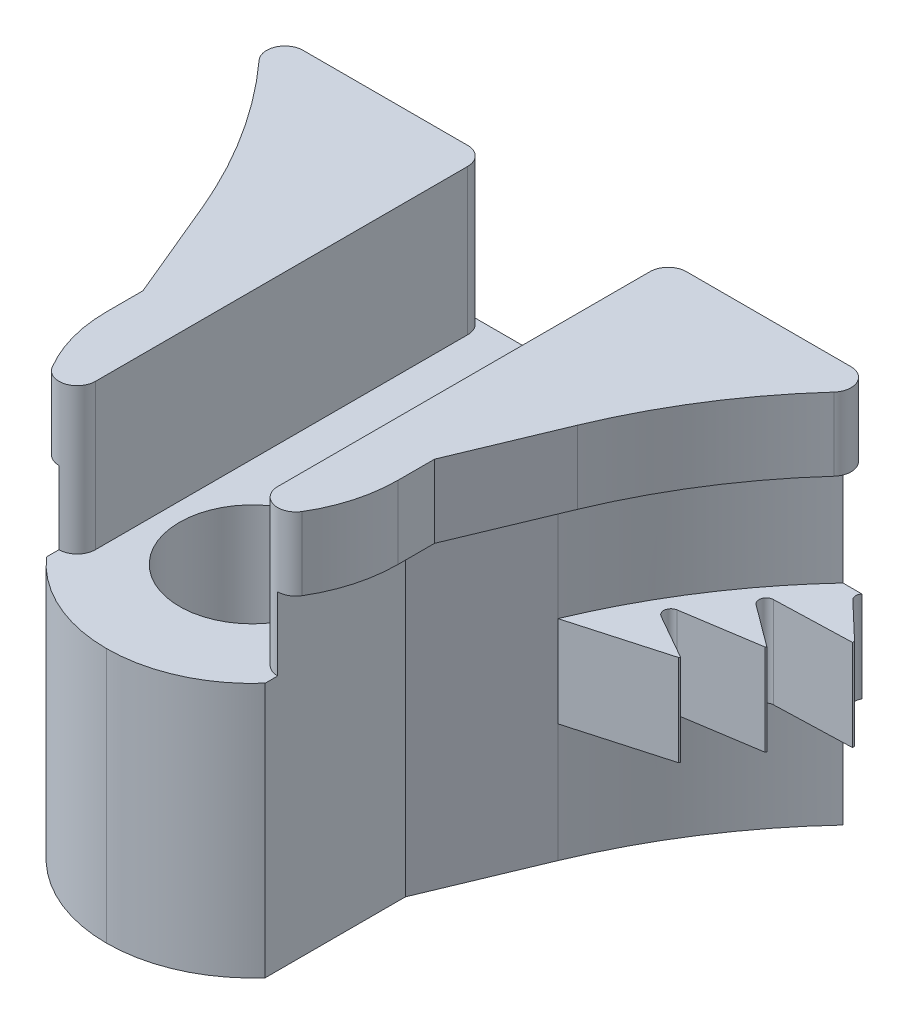
from build123d import *

# Parameters (mm, degrees)
BOSS_EXTRUDE1_DEPTH  = 2.54
BOSS_EXTRUDE2_DEPTH  = 11.43
BOSS_EXTRUDE3_DEPTH  = 1.5875
CUT_EXTRUDE1_DEPTH   = 5.08
CUT_EXTRUDE2_DEPTH   = 5.08
CIRPATTERN1_COUNT    = 10
CIRPATTERN1_ANGLE    = 63
FILLET1_R            = 0.254
MIRROR1_COPY_1_DEPTH = 5.08
MIRROR1_COPY_2_DEPTH = 5.08
MIRROR1_COPY_3_DEPTH = 5.08
MIRROR1_COPY_4_DEPTH = 5.08
MIRROR1_COPY_5_DEPTH = 5.08
MIRROR1_COPY_6_DEPTH = 5.08
MIRROR1_COPY_7_DEPTH = 5.08
MIRROR1_COPY_8_DEPTH = 5.08
MIRROR1_COPY_9_DEPTH = 5.08
FILLET1_OF_MIRROR1_R = 0.254
FILLET3_R            = 5.08
SKETCH8_R            = 2.54
CUT_EXTRUDE3_DEPTH   = 37.969969278
SKETCH9_W            = 6.35
SKETCH9_H            = 5.08
CUT_EXTRUDE4_DEPTH   = 37.086876125
FILLET5_R            = 1.27
FILLET6_R            = 0.635
SKETCH10_W           = 12.288229788
SKETCH10_H           = 22.793910423
CUT_EXTRUDE5_DEPTH   = 37.969969278
SKETCH11_W           = 22.446987528
SKETCH11_H           = 9.005342915
CUT_EXTRUDE6_DEPTH   = 32.085168686
FILLET7_R            = 0.635


# Some blends are built 0.0001 mm under size
with BuildPart() as part:
    # Sketch1 → Boss-Extrude1 (new body)
    with BuildSketch(Plane(origin=(0, 0, 0), x_dir=(1, 0, 0), z_dir=(0, 1, 0))):
        with BuildLine():
            Line((-22.86, 25.4), (22.86, 25.4))
            Line((22.86, 25.4), (22.86, 21.547619525))
            ThreePointArc((22.86, 21.547619525), (13.040193974, 18.029309291), (6.545384615, 9.866923077))
            Line((6.545384615, 9.866923077), (5.08, 6.35))
            Line((5.08, 6.35), (5.08, 0))
            Line((5.08, 0), (-5.08, 0))
            Line((-5.08, 0), (-5.08, 6.35))
            Line((-5.08, 6.35), (-6.545384615, 9.866923077))
            ThreePointArc((-6.545384615, 9.866923077), (-13.040193974, 18.029309291), (-22.86, 21.547619525))
            Line((-22.86, 21.547619525), (-22.86, 25.4))
        make_face()
    extrude(amount=BOSS_EXTRUDE1_DEPTH)

    # Sketch3 → Boss-Extrude2 (add)
    with BuildSketch(Plane.XZ):
        with BuildLine():
            Line((-3.81, 0), (0, 0))
            Line((0, 0), (0, -25.4))
            Line((0, -25.4), (-21.59, -25.4))
            Line((-21.59, -25.4), (-22.86, -25.4))
            Line((-22.86, -25.4), (-22.86, -22.70062499))
            Line((-22.86, -22.70062499), (-21.59, -22.70062499))
            ThreePointArc((-21.59, -22.70062499), (-11.821833073, -18.70822275), (-5.373076923, -10.355384615))
            Line((-5.373076923, -10.355384615), (-3.81, -6.604))
            Line((-3.81, -6.604), (-3.81, 0))
        make_face()
    boss_extrude2 = extrude(amount=BOSS_EXTRUDE2_DEPTH)

    # Sketch4 → Boss-Extrude3 (add, symmetric)
    with BuildSketch(Plane(origin=(0, -5.715, 0), x_dir=(-1, 0, 0), z_dir=(0, -1, 0))):
        with BuildLine():
            Line((22.944666667, 20.28044489), (22.944666667, 25.4))
            Line((22.944666667, 25.4), (0, 25.4))
            Line((0, 25.4), (0, 0))
            Line((0, 0), (3.81, 0))
            Line((3.81, 0), (3.81, 6.604))
            Line((3.81, 6.604), (4.966025641, 9.378461538))
            Line((4.966025641, 9.378461538), (7.717692308, 9.378461538))
            ThreePointArc((7.717692308, 9.378461538), (13.779514375, 16.996688671), (22.944666667, 20.28044489))
        make_face()
    boss_extrude3 = extrude(amount=BOSS_EXTRUDE3_DEPTH, both=True)

    # Sketch6 → Cut-Extrude1 (cut)
    with BuildSketch(Plane.XZ.offset(7.3025)):
        Polygon((-7.717692308, -9.378461538), (-5.373076923, -10.355384615), (-8.648388962, -11.283461538), align=None)
    cut_extrude1 = extrude(amount=-CUT_EXTRUDE1_DEPTH, mode=Mode.SUBTRACT)

    # Sketch7 → Cut-Extrude2 (cut)
    with BuildSketch(Plane.XZ.offset(7.3025)):
        Polygon((-7.717692308, -9.378461538), (-5.373076923, -10.355384615), (-4.966025641, -9.378461538), align=None)
    cut_extrude2 = extrude(amount=-CUT_EXTRUDE2_DEPTH, mode=Mode.SUBTRACT)

    # CirPattern1: Cut-Extrude1 ×10 about axis
    cirpattern1_axis = Axis((-24.13, 0, -2.54), (0, 1, 0))
    for i in range(1, CIRPATTERN1_COUNT):
        add(cut_extrude1.rotate(cirpattern1_axis, i * CIRPATTERN1_ANGLE / (CIRPATTERN1_COUNT - 1)), mode=Mode.SUBTRACT)

    # Fillet1
    # the kernel refuses this fillet: 0.254 mm, written as the material it adds along each edge
    with BuildSketch(Plane(origin=(-22.5780938, -7.3025, -22.800651202), x_dir=(-0.07637333661020333, 0, 0.9970792914583196), z_dir=(0, 1, 0))) as fillet1_piece_1_section:
        with BuildLine():
            CenterArc((0.663062221, -0.254), FILLET1_R, 90, 108.665400871)
            Line((0.422421678, -0.335290399), (0.417608867, -0.336916207))
            ThreePointArc((0.417608867, -0.336916207), (0.208052614, -0.171624146), (-0.003158225, -0.003978947))
            Line((-0.003158225, -0.003978947), (0, 0.00508))
            Line((0, 0.00508), (0.663062221, 0.00508))
            Line((0.663062221, 0.00508), (0.663062221, 0))
        make_face()
    fillet1_piece_1 = extrude(amount=5.08, mode=Mode.PRIVATE)
    fillet1_piece_1 = split(fillet1_piece_1, bisect_by=Plane(origin=(-22.705091863, -5.715, -22.70062499), z_dir=(0, 0, 1)), keep=Keep.TOP, mode=Mode.PRIVATE)
    fillet1_piece_1 = split(fillet1_piece_1, bisect_by=Plane(origin=(-22.705091863, -4.1275, -22.489092759), z_dir=(0, -1, 0)), keep=Keep.TOP, mode=Mode.PRIVATE)
    fillet1_piece_1 = split(fillet1_piece_1, bisect_by=Plane(origin=(-22.944666667, -5.715, -22.489092759), z_dir=(1, 0, 0)), keep=Keep.TOP, mode=Mode.PRIVATE)
    add(fillet1_piece_1)
    with BuildSketch(Plane(origin=(-22.5780938, -8.960155552, -22.800651202), x_dir=(-0.07637333661019842, 0, 0.99707929145832), z_dir=(0, 1, 0))) as fillet1_piece_2_section:
        with BuildLine():
            CenterArc((0.663062221, -0.254), FILLET1_R, 90, 108.665400871)
            Line((0.422421678, -0.335290399), (0.417608867, -0.336916207))
            ThreePointArc((0.417608867, -0.336916207), (0.208052614, -0.171624146), (-0.003158225, -0.003978947))
            Line((-0.003158225, -0.003978947), (0, 0.00508))
            Line((0, 0.00508), (0.663062221, 0.00508))
            Line((0.663062221, 0.00508), (0.663062221, 0))
        make_face()
    fillet1_piece_2 = extrude(amount=6.737655552, mode=Mode.PRIVATE)
    fillet1_piece_2 = split(fillet1_piece_2, bisect_by=Plane(origin=(-22.610568063, -8.131327776, -22.70062499), z_dir=(0, 0, -1)), keep=Keep.TOP, mode=Mode.PRIVATE)
    fillet1_piece_2 = split(fillet1_piece_2, bisect_by=Plane(origin=(-22.610568063, -7.3025, -22.737867725), z_dir=(0, -1, 0)), keep=Keep.TOP, mode=Mode.PRIVATE)
    add(fillet1_piece_2)
    with BuildSketch(Plane(origin=(-22.5780938, -7.3025, -22.800651202), x_dir=(-0.07637333661020333, 0, 0.9970792914583196), z_dir=(0, 1, 0))) as fillet1_piece_3_section:
        with BuildLine():
            CenterArc((0.663062221, -0.254), FILLET1_R, 90, 108.665400871)
            Line((0.422421678, -0.335290399), (0.417608867, -0.336916207))
            ThreePointArc((0.417608867, -0.336916207), (0.208052614, -0.171624146), (-0.003158225, -0.003978947))
            Line((-0.003158225, -0.003978947), (0, 0.00508))
            Line((0, 0.00508), (0.663062221, 0.00508))
            Line((0.663062221, 0.00508), (0.663062221, 0))
        make_face()
    fillet1_piece_3 = extrude(amount=5.08, mode=Mode.PRIVATE)
    fillet1_piece_3 = split(fillet1_piece_3, bisect_by=Plane(origin=(-22.610568063, -5.715, -22.70062499), z_dir=(0, 0, -1)), keep=Keep.TOP, mode=Mode.PRIVATE)
    fillet1_piece_3 = split(fillet1_piece_3, bisect_by=Plane(origin=(-22.610568063, -4.1275, -22.737867725), z_dir=(0, -1, 0)), keep=Keep.TOP, mode=Mode.PRIVATE)
    add(fillet1_piece_3)
    with BuildSketch(Plane(origin=(-22.5780938, -7.3025, -22.800651202), x_dir=(-0.07637333661020333, 0, 0.9970792914583196), z_dir=(0, 1, 0))) as fillet1_piece_4_section:
        with BuildLine():
            CenterArc((0.663062221, -0.254), FILLET1_R, 90, 108.665400871)
            Line((0.422421678, -0.335290399), (0.417608867, -0.336916207))
            ThreePointArc((0.417608867, -0.336916207), (0.208052614, -0.171624146), (-0.003158225, -0.003978947))
            Line((-0.003158225, -0.003978947), (0, 0.00508))
            Line((0, 0.00508), (0.663062221, 0.00508))
            Line((0.663062221, 0.00508), (0.663062221, 0))
        make_face()
    fillet1_piece_4 = extrude(amount=5.08, mode=Mode.PRIVATE)
    fillet1_piece_4 = split(fillet1_piece_4, bisect_by=Plane(origin=(-22.610568063, -3.175, -22.70062499), z_dir=(0, 0, -1)), keep=Keep.TOP, mode=Mode.PRIVATE)
    fillet1_piece_4 = split(fillet1_piece_4, bisect_by=Plane(origin=(-22.610568063, -4.1275, -22.737867725), z_dir=(0, 1, 0)), keep=Keep.TOP, mode=Mode.PRIVATE)
    add(fillet1_piece_4)
    with BuildSketch(Plane(origin=(-22.5780938, -7.3025, -22.800651202), x_dir=(-0.07637333661020333, 0, 0.9970792914583196), z_dir=(0, 1, 0))) as fillet1_piece_5_section:
        with BuildLine():
            CenterArc((0.663062221, -0.254), FILLET1_R, 90, 108.665400871)
            Line((0.422421678, -0.335290399), (0.417608867, -0.336916207))
            ThreePointArc((0.417608867, -0.336916207), (0.208052614, -0.171624146), (-0.003158225, -0.003978947))
            Line((-0.003158225, -0.003978947), (0, 0.00508))
            Line((0, 0.00508), (0.663062221, 0.00508))
            Line((0.663062221, 0.00508), (0.663062221, 0))
        make_face()
    fillet1_piece_5 = extrude(amount=6.737655552, mode=Mode.PRIVATE)
    fillet1_piece_5 = split(fillet1_piece_5, bisect_by=Plane(origin=(-22.610568063, -1.393672224, -22.70062499), z_dir=(0, 0, -1)), keep=Keep.TOP, mode=Mode.PRIVATE)
    fillet1_piece_5 = split(fillet1_piece_5, bisect_by=Plane(origin=(-22.610568063, -2.2225, -22.737867725), z_dir=(0, 1, 0)), keep=Keep.TOP, mode=Mode.PRIVATE)
    add(fillet1_piece_5)
    with BuildSketch(Plane(origin=(-20.120509215, -7.3025, -22.460501591), x_dir=(-0.7640253133482992, 0, 0.6451862681141263), z_dir=(0, 1, 0)), Plane(origin=(-17.722696902, -7.3025, -21.823383184), x_dir=(-0.836958811389497, 0, 0.5472658842258308), z_dir=(0, 1, 0)), Plane(origin=(-15.42040272, -7.3025, -20.898793948), x_dir=(-0.8974151813055786, 0, 0.4411870265117453), z_dir=(0, 1, 0)), Plane(origin=(-13.247948573, -7.3025, -19.70051738), x_dir=(-0.9444931578692072, 0, 0.3285310864107881), z_dir=(0, 1, 0))) as fillet1_piece_6:
        with BuildLine():
            CenterArc((FILLET1_R * 2.86836666105, FILLET1_R), FILLET1_R, 128.440222299, 141.559777701)
            Line((FILLET1_R * 2.24666887201, FILLET1_R * 1.78325721133), (FILLET1_R * 2.23423491622, FILLET1_R * 1.79892235556))
            Line((FILLET1_R * 2.23423491622, FILLET1_R * 1.79892235556), (-FILLET1_R * 0.0124339557808, FILLET1_R * 0.0156651442266))
            Line((-FILLET1_R * 0.0124339557808, FILLET1_R * 0.0156651442266), (0, -FILLET1_R * 0.02))
            Line((0, -FILLET1_R * 0.02), (FILLET1_R * 2.86836666105, -FILLET1_R * 0.02))
            Line((FILLET1_R * 2.86836666105, -FILLET1_R * 0.02), (FILLET1_R * 2.86836666105, 0))
        make_face()
    extrude(amount=3.175)
    with BuildSketch(Plane(origin=(-11.237720749, -7.3025, -18.246417023), x_dir=(-0.6344625615675041, 0, 0.772953593671186), z_dir=(0, 1, 0)), Plane(origin=(-9.419687114, -7.3025, -16.558170165), x_dir=(-0.723932720787678, 0, 0.6898705790022863), z_dir=(0, 1, 0)), Plane(origin=(-7.820950361, -7.3025, -14.660944678), x_dir=(-0.8026107105625789, 0, 0.5965031829673938), z_dir=(0, 1, 0)), Plane(origin=(-6.465343975, -7.3025, -12.583023823), x_dir=(-0.8693236232823137, 0, 0.49424329838988196), z_dir=(0, 1, 0))) as fillet1_piece_7:
        with BuildLine():
            CenterArc((FILLET1_R * 2.86836666105, -FILLET1_R), FILLET1_R, 90, 141.559777701)
            Line((FILLET1_R * 2.24666887201, -FILLET1_R * 1.78325721133), (FILLET1_R * 2.23423491622, -FILLET1_R * 1.79892235556))
            Line((FILLET1_R * 2.23423491622, -FILLET1_R * 1.79892235556), (-FILLET1_R * 0.0124339557808, -FILLET1_R * 0.0156651442266))
            Line((-FILLET1_R * 0.0124339557808, -FILLET1_R * 0.0156651442266), (0, FILLET1_R * 0.02))
            Line((0, FILLET1_R * 0.02), (FILLET1_R * 2.86836666105, FILLET1_R * 0.02))
            Line((FILLET1_R * 2.86836666105, FILLET1_R * 0.02), (FILLET1_R * 2.86836666105, 0))
        make_face()
    extrude(amount=3.175)

    # Mirror1: Boss-Extrude2, Boss-Extrude3, Cut-Extrude1, Cut-Extrude2 across plane
    add(boss_extrude2.mirror(Plane(origin=(0, -11.43, 0), x_dir=(0, 0, 1), z_dir=(-1, 0, 0))))
    add(boss_extrude3.mirror(Plane(origin=(0, -11.43, 0), x_dir=(0, 0, 1), z_dir=(-1, 0, 0))))
    add(cut_extrude1.mirror(Plane(origin=(0, -11.43, 0), x_dir=(0, 0, 1), z_dir=(-1, 0, 0))), mode=Mode.SUBTRACT)
    add(cut_extrude2.mirror(Plane(origin=(0, -11.43, 0), x_dir=(0, 0, 1), z_dir=(-1, 0, 0))), mode=Mode.SUBTRACT)

    # Mirror1 copy 1 sketch → Mirror1 copy 1 (cut)
    with BuildSketch(Plane(origin=(-0.129686771, -7.3025, -2.959640031), x_dir=(-0.992546151641322, 0, -0.12186934340514778), z_dir=(0, -1, 0))):
        Polygon((-7.717692308, 9.378461538), (-5.373076923, 10.355384615), (-8.648388962, 11.283461538), align=None)
    extrude(amount=-MIRROR1_COPY_1_DEPTH, mode=Mode.SUBTRACT)

    # Mirror1 copy 2 sketch → Mirror1 copy 2 (cut)
    with BuildSketch(Plane(origin=(0.10228251, -7.3025, -5.913024196), x_dir=(-0.9702957262759964, 0, -0.2419218955996683), z_dir=(0, -1, 0))):
        Polygon((-7.717692308, 9.378461538), (-5.373076923, 10.355384615), (-8.648388962, 11.283461538), align=None)
    extrude(amount=-MIRROR1_COPY_2_DEPTH, mode=Mode.SUBTRACT)

    # Mirror1 copy 3 sketch → Mirror1 copy 3 (cut)
    with BuildSketch(Plane(origin=(0.692449717, -7.3025, -8.816124339), x_dir=(-0.9335804264972014, 0, -0.35836794954530116), z_dir=(0, -1, 0))):
        Polygon((-7.717692308, 9.378461538), (-5.373076923, 10.355384615), (-8.648388962, 11.283461538), align=None)
    extrude(amount=-MIRROR1_COPY_3_DEPTH, mode=Mode.SUBTRACT)

    # Mirror1 copy 4 sketch → Mirror1 copy 4 (cut)
    with BuildSketch(Plane(origin=(1.632016815, -7.3025, -11.625661924), x_dir=(-0.8829475928589263, 0, -0.46947156278589186), z_dir=(0, -1, 0))):
        Polygon((-7.717692308, 9.378461538), (-5.373076923, 10.355384615), (-8.648388962, 11.283461538), align=None)
    extrude(amount=-MIRROR1_COPY_4_DEPTH, mode=Mode.SUBTRACT)

    # Mirror1 copy 5 sketch → Mirror1 copy 5 (cut)
    with BuildSketch(Plane(origin=(2.906977023, -7.3025, -14.299753217), x_dir=(-0.8191520442889909, 0, -0.5735764363510474), z_dir=(0, -1, 0))):
        Polygon((-7.717692308, 9.378461538), (-5.373076923, 10.355384615), (-8.648388962, 11.283461538), align=None)
    extrude(amount=-MIRROR1_COPY_5_DEPTH, mode=Mode.SUBTRACT)

    # Mirror1 copy 6 sketch → Mirror1 copy 6 (cut)
    with BuildSketch(Plane(origin=(4.498323621, -7.3025, -16.798533675), x_dir=(-0.7431448254773929, 0, -0.6691306063588596), z_dir=(0, -1, 0))):
        Polygon((-7.717692308, 9.378461538), (-5.373076923, 10.355384615), (-8.648388962, 11.283461538), align=None)
    extrude(amount=-MIRROR1_COPY_6_DEPTH, mode=Mode.SUBTRACT)

    # Mirror1 copy 7 sketch → Mirror1 copy 7 (cut)
    with BuildSketch(Plane(origin=(6.382333297, -7.3025, -19.084752237), x_dir=(-0.6560590289905056, 0, -0.7547095802227735), z_dir=(0, -1, 0))):
        Polygon((-7.717692308, 9.378461538), (-5.373076923, 10.355384615), (-8.648388962, 11.283461538), align=None)
    extrude(amount=-MIRROR1_COPY_7_DEPTH, mode=Mode.SUBTRACT)

    # Mirror1 copy 8 sketch → Mirror1 copy 8 (cut)
    with BuildSketch(Plane(origin=(8.530919805, -7.3025, -21.124326651), x_dir=(-0.5591929034707448, 0, -0.8290375725550431), z_dir=(0, -1, 0))):
        Polygon((-7.717692308, 9.378461538), (-5.373076923, 10.355384615), (-8.648388962, 11.283461538), align=None)
    extrude(amount=-MIRROR1_COPY_8_DEPTH, mode=Mode.SUBTRACT)

    # Mirror1 copy 9 sketch → Mirror1 copy 9 (cut)
    with BuildSketch(Plane(origin=(10.91205267, -7.3025, -22.886851559), x_dir=(-0.4539904997395445, 0, -0.891006524188369), z_dir=(0, -1, 0))):
        Polygon((-7.717692308, 9.378461538), (-5.373076923, 10.355384615), (-8.648388962, 11.283461538), align=None)
    extrude(amount=-MIRROR1_COPY_9_DEPTH, mode=Mode.SUBTRACT)

    # Fillet1 of Mirror1
    # the kernel refuses this fillet: 0.254 mm, written as the material it adds along each edge
    with BuildSketch(Plane(origin=(22.5780938, -7.3025, -22.800651202), x_dir=(0.679701957651323, 0, 0.733488410791172), z_dir=(0, 1, 0))) as fillet1_of_mirror1_piece_1_section:
        with BuildLine():
            CenterArc((0.677259504, -0.213276985), FILLET1_OF_MIRROR1_R, 122.89437683, 108.665400871)
            Line((0.519348266, -0.412224317), (0.516190041, -0.416203263))
            Line((0.516190041, -0.416203263), (-0.003158225, -0.003978947))
            Line((-0.003158225, -0.003978947), (0, 0.00508))
            ThreePointArc((0, 0.00508), (0.269657063, 0.00508), (0.536555217, 0.00426554))
            Line((0.536555217, 0.00426554), (0.539314125, 0))
        make_face()
    fillet1_of_mirror1_piece_1 = extrude(amount=5.08, mode=Mode.PRIVATE)
    fillet1_of_mirror1_piece_1 = split(fillet1_of_mirror1_piece_1, bisect_by=Plane(origin=(22.705091863, -4.1275, -22.489092759), z_dir=(0, -1, 0)), keep=Keep.TOP, mode=Mode.PRIVATE)
    fillet1_of_mirror1_piece_1 = split(fillet1_of_mirror1_piece_1, bisect_by=Plane(origin=(22.944666667, -5.715, -22.489092759), z_dir=(-1, 0, 0)), keep=Keep.TOP, mode=Mode.PRIVATE)
    fillet1_of_mirror1_piece_1 = split(fillet1_of_mirror1_piece_1, bisect_by=Plane(origin=(22.705091863, -5.715, -22.70062499), z_dir=(0, 0, 1)), keep=Keep.TOP, mode=Mode.PRIVATE)
    add(fillet1_of_mirror1_piece_1)
    with BuildSketch(Plane(origin=(22.5780938, -8.960155552, -22.800651202), x_dir=(0.6797019576513229, 0, 0.7334884107911723), z_dir=(0, 1, 0))) as fillet1_of_mirror1_piece_2_section:
        with BuildLine():
            CenterArc((0.677259504, -0.213276985), FILLET1_OF_MIRROR1_R, 122.89437683, 108.665400871)
            Line((0.519348266, -0.412224317), (0.516190041, -0.416203263))
            Line((0.516190041, -0.416203263), (-0.003158225, -0.003978947))
            Line((-0.003158225, -0.003978947), (0, 0.00508))
            ThreePointArc((0, 0.00508), (0.269657063, 0.00508), (0.536555217, 0.00426554))
            Line((0.536555217, 0.00426554), (0.539314125, 0))
        make_face()
    fillet1_of_mirror1_piece_2 = extrude(amount=6.737655552, mode=Mode.PRIVATE)
    fillet1_of_mirror1_piece_2 = split(fillet1_of_mirror1_piece_2, bisect_by=Plane(origin=(22.610568063, -8.131327776, -22.70062499), z_dir=(0, 0, -1)), keep=Keep.TOP, mode=Mode.PRIVATE)
    fillet1_of_mirror1_piece_2 = split(fillet1_of_mirror1_piece_2, bisect_by=Plane(origin=(22.610568063, -7.3025, -22.737867725), z_dir=(0, -1, 0)), keep=Keep.TOP, mode=Mode.PRIVATE)
    add(fillet1_of_mirror1_piece_2)
    with BuildSketch(Plane(origin=(22.5780938, -7.3025, -22.800651202), x_dir=(0.679701957651323, 0, 0.733488410791172), z_dir=(0, 1, 0))) as fillet1_of_mirror1_piece_3_section:
        with BuildLine():
            CenterArc((0.677259504, -0.213276985), FILLET1_OF_MIRROR1_R, 122.89437683, 108.665400871)
            Line((0.519348266, -0.412224317), (0.516190041, -0.416203263))
            Line((0.516190041, -0.416203263), (-0.003158225, -0.003978947))
            Line((-0.003158225, -0.003978947), (0, 0.00508))
            ThreePointArc((0, 0.00508), (0.269657063, 0.00508), (0.536555217, 0.00426554))
            Line((0.536555217, 0.00426554), (0.539314125, 0))
        make_face()
    fillet1_of_mirror1_piece_3 = extrude(amount=5.08, mode=Mode.PRIVATE)
    fillet1_of_mirror1_piece_3 = split(fillet1_of_mirror1_piece_3, bisect_by=Plane(origin=(22.610568063, -4.1275, -22.737867725), z_dir=(0, -1, 0)), keep=Keep.TOP, mode=Mode.PRIVATE)
    fillet1_of_mirror1_piece_3 = split(fillet1_of_mirror1_piece_3, bisect_by=Plane(origin=(22.610568063, -5.715, -22.70062499), z_dir=(0, 0, -1)), keep=Keep.TOP, mode=Mode.PRIVATE)
    add(fillet1_of_mirror1_piece_3)
    with BuildSketch(Plane(origin=(22.5780938, -7.3025, -22.800651202), x_dir=(0.679701957651323, 0, 0.733488410791172), z_dir=(0, 1, 0))) as fillet1_of_mirror1_piece_4_section:
        with BuildLine():
            CenterArc((0.677259504, -0.213276985), FILLET1_OF_MIRROR1_R, 122.89437683, 108.665400871)
            Line((0.519348266, -0.412224317), (0.516190041, -0.416203263))
            Line((0.516190041, -0.416203263), (-0.003158225, -0.003978947))
            Line((-0.003158225, -0.003978947), (0, 0.00508))
            ThreePointArc((0, 0.00508), (0.269657063, 0.00508), (0.536555217, 0.00426554))
            Line((0.536555217, 0.00426554), (0.539314125, 0))
        make_face()
    fillet1_of_mirror1_piece_4 = extrude(amount=5.08, mode=Mode.PRIVATE)
    fillet1_of_mirror1_piece_4 = split(fillet1_of_mirror1_piece_4, bisect_by=Plane(origin=(22.610568063, -4.1275, -22.737867725), z_dir=(0, 1, 0)), keep=Keep.TOP, mode=Mode.PRIVATE)
    fillet1_of_mirror1_piece_4 = split(fillet1_of_mirror1_piece_4, bisect_by=Plane(origin=(22.610568063, -3.175, -22.70062499), z_dir=(0, 0, -1)), keep=Keep.TOP, mode=Mode.PRIVATE)
    add(fillet1_of_mirror1_piece_4)
    with BuildSketch(Plane(origin=(22.5780938, -7.3025, -22.800651202), x_dir=(0.679701957651323, 0, 0.733488410791172), z_dir=(0, 1, 0))) as fillet1_of_mirror1_piece_5_section:
        with BuildLine():
            CenterArc((0.677259504, -0.213276985), FILLET1_OF_MIRROR1_R, 122.89437683, 108.665400871)
            Line((0.519348266, -0.412224317), (0.516190041, -0.416203263))
            Line((0.516190041, -0.416203263), (-0.003158225, -0.003978947))
            Line((-0.003158225, -0.003978947), (0, 0.00508))
            ThreePointArc((0, 0.00508), (0.269657063, 0.00508), (0.536555217, 0.00426554))
            Line((0.536555217, 0.00426554), (0.539314125, 0))
        make_face()
    fillet1_of_mirror1_piece_5 = extrude(amount=6.737655552, mode=Mode.PRIVATE)
    fillet1_of_mirror1_piece_5 = split(fillet1_of_mirror1_piece_5, bisect_by=Plane(origin=(22.610568063, -1.393672224, -22.70062499), z_dir=(0, 0, -1)), keep=Keep.TOP, mode=Mode.PRIVATE)
    fillet1_of_mirror1_piece_5 = split(fillet1_of_mirror1_piece_5, bisect_by=Plane(origin=(22.610568063, -2.2225, -22.737867725), z_dir=(0, 1, 0)), keep=Keep.TOP, mode=Mode.PRIVATE)
    add(fillet1_of_mirror1_piece_5)
    with BuildSketch(Plane(origin=(20.120509215, -7.3025, -22.460501591), x_dir=(0.7640253133482992, 0, 0.6451862681141263), z_dir=(0, 1, 0)), Plane(origin=(17.722696902, -7.3025, -21.823383184), x_dir=(0.836958811389497, 0, 0.5472658842258308), z_dir=(0, 1, 0)), Plane(origin=(15.42040272, -7.3025, -20.898793948), x_dir=(0.8974151813055792, 0, 0.44118702651174435), z_dir=(0, 1, 0)), Plane(origin=(13.247948573, -7.3025, -19.70051738), x_dir=(0.9444931578692072, 0, 0.3285310864107881), z_dir=(0, 1, 0)), Plane(origin=(11.237720749, -7.3025, -18.246417023), x_dir=(0.9774909168837043, 0, 0.21097750451139333), z_dir=(0, 1, 0)), Plane(origin=(9.419687114, -7.3025, -16.558170165), x_dir=(0.995916537765328, 0, 0.0902787339605628), z_dir=(0, 1, 0)), Plane(origin=(7.820950361, -7.3025, -14.660944678), x_dir=(0.9994953369461473, 0, -0.03176588457618356), z_dir=(0, 1, 0)), Plane(origin=(6.465343975, -7.3025, -12.583023823), x_dir=(0.9881739627733617, 0, -0.15333694693970756), z_dir=(0, 1, 0))) as fillet1_of_mirror1_piece_6:
        with BuildLine():
            CenterArc((FILLET1_OF_MIRROR1_R * 2.86836666105, -FILLET1_OF_MIRROR1_R), FILLET1_OF_MIRROR1_R, 90, 141.559777701)
            Line((FILLET1_OF_MIRROR1_R * 2.24666887201, -FILLET1_OF_MIRROR1_R * 1.78325721133), (FILLET1_OF_MIRROR1_R * 2.23423491622, -FILLET1_OF_MIRROR1_R * 1.79892235556))
            Line((FILLET1_OF_MIRROR1_R * 2.23423491622, -FILLET1_OF_MIRROR1_R * 1.79892235556), (-FILLET1_OF_MIRROR1_R * 0.0124339557808, -FILLET1_OF_MIRROR1_R * 0.0156651442266))
            Line((-FILLET1_OF_MIRROR1_R * 0.0124339557808, -FILLET1_OF_MIRROR1_R * 0.0156651442266), (0, FILLET1_OF_MIRROR1_R * 0.02))
            Line((0, FILLET1_OF_MIRROR1_R * 0.02), (FILLET1_OF_MIRROR1_R * 2.86836666105, FILLET1_OF_MIRROR1_R * 0.02))
            Line((FILLET1_OF_MIRROR1_R * 2.86836666105, FILLET1_OF_MIRROR1_R * 0.02), (FILLET1_OF_MIRROR1_R * 2.86836666105, 0))
        make_face()
    extrude(amount=3.175)

    # Fillet3
    fillet3_edges = [part.edges().sort_by_distance(p)[0] for p in [
        (5.08, 1.27, 0),
        (-5.08, 1.27, 0),
    ]]
    fillet(fillet3_edges, radius=FILLET3_R - 0.0001)  # a hair under: the kernel refuses the full size

    # Sketch8 → Cut-Extrude3 (cut, through all)
    with BuildSketch(Plane.XZ.offset(11.43)):
        with Locations(Location((0, -5.08, 0), (0, 0, 270))):
            Circle(SKETCH8_R)
    extrude(amount=-CUT_EXTRUDE3_DEPTH, mode=Mode.SUBTRACT)

    # Sketch9 → Cut-Extrude4 (cut, through all)
    with BuildSketch(Plane.XY.offset(-25.4)):
        Rectangle(SKETCH9_W, SKETCH9_H)
    extrude(amount=CUT_EXTRUDE4_DEPTH, mode=Mode.SUBTRACT)

    # Fillet5
    fillet5_edges = [part.edges().sort_by_distance(p)[0] for p in [
        (-22.86, 1.27, -21.547619525),
        (-22.86, -9.36625, -22.70062499),
        (-22.86, -2.06375, -22.70062499),
        (22.86, 1.27, -21.547619525),
        (22.86, -2.06375, -22.70062499),
        (22.86, -9.36625, -22.70062499),
        (22.86, -0.79375, -25.4),
        (-22.86, -0.79375, -25.4),
    ]]
    fillet(fillet5_edges, radius=FILLET5_R - 0.0001)  # a hair under: the kernel refuses the full size

    # Fillet6
    # the kernel refuses this fillet: 0.635 mm, written as the material it takes off along each edge
    with BuildSketch(Plane(origin=(3.175, -2.54, -1.11437431), x_dir=(0, 0, -1), z_dir=(0, 1, 0))) as fillet6_piece_1:
        with BuildLine():
            CenterArc((1.676028366, -0.635), FILLET6_R, 90, 148.996923357)
            ThreePointArc((1.348949961, -1.179283673), (0.622070551, -0.649585814), (0, 0))
            Line((0, 0), (1.676028366, 0))
        make_face()
    extrude(amount=9.559380523, mode=Mode.SUBTRACT)
    with BuildSketch(Plane(origin=(-3.175, -2.54, -1.11437431), x_dir=(0, 0, -1), z_dir=(0, 1, 0))) as fillet6_piece_2:
        with BuildLine():
            CenterArc((1.676028366, 0.635), FILLET6_R, 121.003076643, 148.996923357)
            ThreePointArc((1.348949961, 1.179283673), (0.622070551, 0.649585814), (0, 0))
            Line((0, 0), (1.676028366, 0))
        make_face()
    extrude(amount=9.559380523, mode=Mode.SUBTRACT)

    # Sketch10 → Cut-Extrude5 (cut, through all)
    with BuildSketch(Plane(origin=(0, 2.54, 0), x_dir=(1, 0, 0), z_dir=(0, 1, 0))):
        with Locations((-17.367608658, 14.003044789)):
            Rectangle(SKETCH10_W, SKETCH10_H)
        with Locations((17.367608658, 14.003044789)):
            Rectangle(SKETCH10_W, SKETCH10_H)
    extrude(amount=-CUT_EXTRUDE5_DEPTH, mode=Mode.SUBTRACT)

    # Sketch11 → Cut-Extrude6 (cut, through all)
    with BuildSketch(Plane(origin=(0, 2.54, 0), x_dir=(1, 0, 0), z_dir=(0, 1, 0))):
        with Locations((0, 20.897328543)):
            Rectangle(SKETCH11_W, SKETCH11_H)
    extrude(amount=-CUT_EXTRUDE6_DEPTH, mode=Mode.SUBTRACT)

    # Fillet7
    fillet7_edges = [part.edges().sort_by_distance(p)[0] for p in [
        (-11.055177743, 1.27, -16.394657085),
        (11.055177743, 1.27, -16.394657085),
        (-3.175, 0, -16.394657085),
        (3.175, 0, -16.394657085),
    ]]
    fillet(fillet7_edges, radius=FILLET7_R)


solid = part.part
